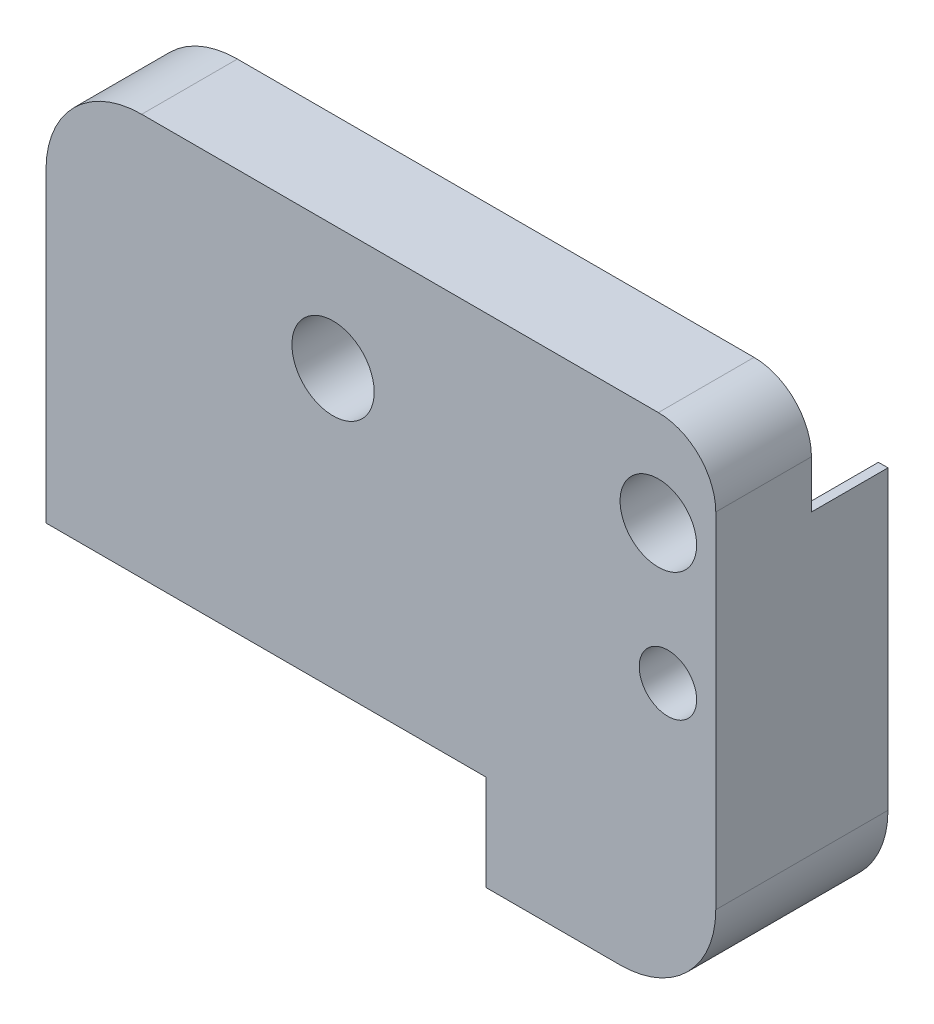
from build123d import *

# Parameters (mm, degrees)
SKETCH1_W             = 23
SKETCH1_H             = 21
EXTRUDE1_DEPTH        = 5
SKETCH2_R             = 2.15
EXTRUDE2_DEPTH        = 4.3
SKETCH3_R             = 4.5
EXTRUDE3_DEPTH        = 4.5
SKETCH4_R             = 1.25
EXTRUDE4_DEPTH        = 8
SKETCH7_W             = 12
SKETCH7_H             = 26
EXTRUDE6_DEPTH        = 5
SKETCH8_R             = 2
EXTRUDE7_DEPTH        = 4
SKETCH9_R             = 1.5
EXTRUDE8_DEPTH        = 5
FILLET2_R             = 3
M3_TAPPED_HOLE1_D     = 2.5
M3_TAPPED_HOLE1_DEPTH = 8
M3_TAPPED_HOLE1_TIP   = 0.751075774
EXTRUDE9_DEPTH        = 4
FILLET1_R             = 5
EXTRUDE10_DEPTH       = 4
FILLET3_R             = 2


with BuildPart() as part:
    # Sketch1 → Extrude1 (new body)
    with BuildSketch(Plane.XY):
        with Locations((-3.5, -4)):
            Rectangle(SKETCH1_W, SKETCH1_H)
    extrude(amount=EXTRUDE1_DEPTH)

    # Sketch2 → Extrude2 (cut)
    with BuildSketch(Plane.XY.offset(5)):
        Circle(SKETCH2_R)
    extrude(amount=-EXTRUDE2_DEPTH, mode=Mode.SUBTRACT)

    # Sketch3 → Extrude3 (cut)
    with BuildSketch(Plane(origin=(0, 0, 0), x_dir=(-1, 0, 0), z_dir=(0, 0, -1))):
        with Locations((4.9, -6.5)):
            Circle(SKETCH3_R)
    extrude(amount=-EXTRUDE3_DEPTH, mode=Mode.SUBTRACT)

    # Sketch4 → Extrude4 (cut)
    with BuildSketch(Plane.XZ.offset(14.5)):
        with Locations(Location((-12, 2.5, 0), (0, 0, 270))):
            Circle(SKETCH4_R)
        with Locations(Location((1.4, 2.5, 0), (0, 0, 270))):
            Circle(SKETCH4_R)
    extrude(amount=-EXTRUDE4_DEPTH, mode=Mode.SUBTRACT)

    # Sketch7 → Extrude6 (add)
    with BuildSketch(Plane.XY.offset(5)):
        with Locations((14, -6.5)):
            Rectangle(SKETCH7_W, SKETCH7_H)
    extrude(amount=-EXTRUDE6_DEPTH)

    # Sketch8 → Extrude7 (cut)
    with BuildSketch(Plane.XY.offset(5)):
        with Locations((17, 1.5)):
            Circle(SKETCH8_R)
    extrude(amount=-EXTRUDE7_DEPTH, mode=Mode.SUBTRACT)

    # Sketch9 → Extrude8 (cut)
    with BuildSketch(Plane.XY.offset(5)):
        with Locations((17.5, -5.5)):
            Circle(SKETCH9_R)
    extrude(amount=-EXTRUDE8_DEPTH, mode=Mode.SUBTRACT)

    # Fillet2
    fillet2_edges = [part.edges().sort_by_distance(p)[0] for p in [
        (20, 6.5, 2.5),
        (20, -19.5, 2.5),
    ]]
    fillet(fillet2_edges, radius=FILLET2_R)

    # M3 Tapped Hole1
    with Locations(Plane(origin=(-12, -14.5, 2.5), x_dir=(0, 0, -1), z_dir=(0, -1, 0))):
        with Locations((0, 0), (0, 13.4)):
            Hole(M3_TAPPED_HOLE1_D / 2, depth=M3_TAPPED_HOLE1_DEPTH)
            with Locations((0, 0, -(M3_TAPPED_HOLE1_DEPTH + M3_TAPPED_HOLE1_TIP / 2))):  # 118° drill point
                Cone(0, M3_TAPPED_HOLE1_D / 2, M3_TAPPED_HOLE1_TIP, mode=Mode.SUBTRACT)

    # Sketch11 → Extrude9 (add)
    with BuildSketch(Plane(origin=(0, 0, 0), x_dir=(-1, 0, 0), z_dir=(0, 0, -1))):
        Polygon((-8, -19.5), (-20, -19.5), (-20, 1), (-18.1, 1), (-2, -11.07), (-2, -14.5), (-8, -14.5), align=None)
    extrude(amount=EXTRUDE9_DEPTH)

    # Fillet1
    fillet1_edges = [part.edges().sort_by_distance(p)[0] for p in [
        (-15, 6.5, 2.5),
        (20, -19.5, -2),
    ]]
    fillet(fillet1_edges, radius=FILLET1_R)

    # Sketch12 → Extrude10 (cut)
    with BuildSketch(Plane(origin=(0, 0, -4), x_dir=(-1, 0, 0), z_dir=(0, 0, -1))):
        Polygon((-19.5, 1), (-19.5, -7.5), (-15.5, -7.5), (-15.5, -0.949192547), (-18.1, 1), align=None)
    extrude(amount=-EXTRUDE10_DEPTH, mode=Mode.SUBTRACT)

    # Fillet3
    fillet3_edges = [part.edges().sort_by_distance(p)[0] for p in [
        (15.5, -7.5, -2),
        (19.5, -7.5, -2),
    ]]
    fillet(fillet3_edges, radius=FILLET3_R - 0.0001)  # a hair under: the kernel refuses the full size


solid = part.part
